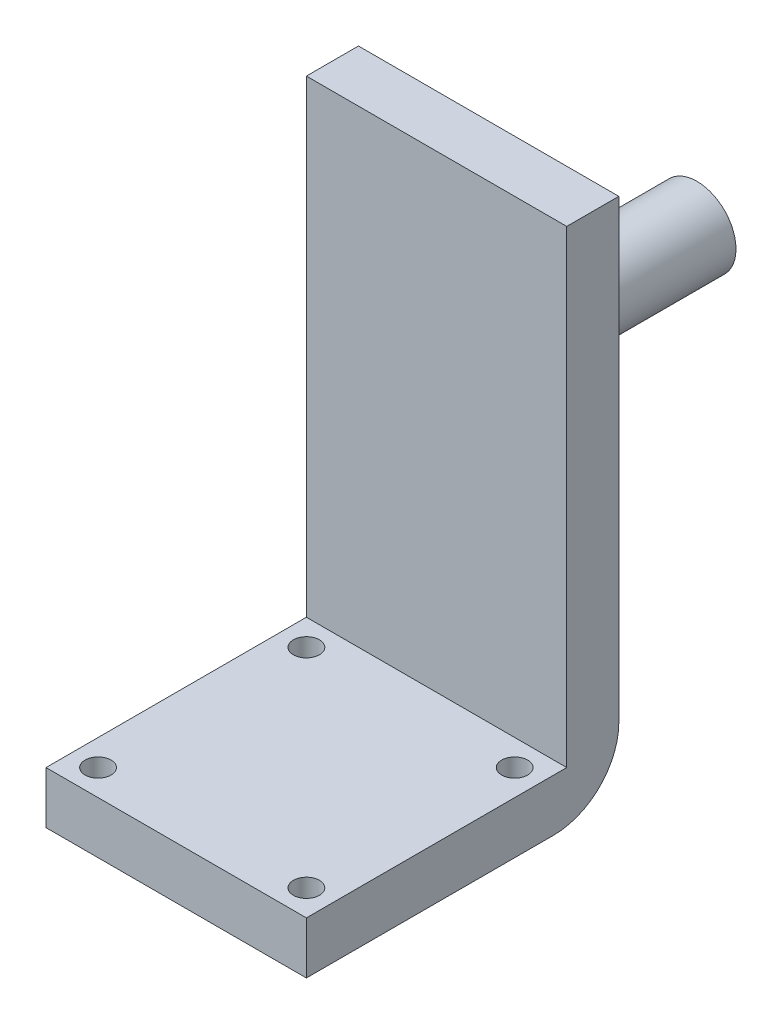
from build123d import *

# Parameters (mm, degrees)
SKETCH1_W           = 20
SKETCH1_H           = 20
SKETCH1_R           = 1
SKETCH1_R_2         = 0.9999999999999998
SKETCH1_R_3         = 1.0000000000000013
SKETCH1_R_4         = 0.9999999999999996
BOSS_EXTRUDE1_DEPTH = 4
SKETCH2_W           = 20
SKETCH2_H           = 40
SKETCH2_R           = 2.9999999999999996
BOSS_EXTRUDE2_DEPTH = 4
FILLET1_R           = 5
SKETCH3_R           = 2.9999999999999996
BOSS_EXTRUDE3_DEPTH = 20


with BuildPart() as part:
    # Sketch1 → Boss-Extrude1 (new body)
    with BuildSketch(Plane(origin=(0, 0, 0), x_dir=(1, 0, 0), z_dir=(0, 1, 0))):
        Rectangle(SKETCH1_W, SKETCH1_H)
        with Locations((-8.000000000000002, 8.000000000000002)):
            Circle(SKETCH1_R, mode=Mode.SUBTRACT)
        with Locations((-8.000000000000002, -7.999999999999998)):
            Circle(SKETCH1_R_2, mode=Mode.SUBTRACT)
        with Locations((7.999999999999998, -7.999999999999998)):
            Circle(SKETCH1_R_3, mode=Mode.SUBTRACT)
        with Locations((8, 8.000000000000002)):
            Circle(SKETCH1_R_4, mode=Mode.SUBTRACT)
    extrude(amount=BOSS_EXTRUDE1_DEPTH)

    # Sketch2 → Boss-Extrude2 (add)
    with BuildSketch(Plane(origin=(0, 0, -10.000000000000002), x_dir=(-1, 0, 0), z_dir=(0, 0, -1))):
        with Locations((1.78e-15, 20)):
            Rectangle(SKETCH2_W, SKETCH2_H)
        with Locations((0, 25)):
            Circle(SKETCH2_R, mode=Mode.SUBTRACT)
    extrude(amount=BOSS_EXTRUDE2_DEPTH)

    # Fillet1
    fillet1_edges = [part.edges().sort_by_distance(p)[0] for p in [
        (-1.78e-15, 0, -14.000000000000002),
    ]]
    fillet(fillet1_edges, radius=FILLET1_R)

    # Sketch3 → Boss-Extrude3 (add)
    with BuildSketch(Plane.XY.offset(-10.000000000000002)):
        with Locations((0, 25)):
            Circle(SKETCH3_R)
    extrude(amount=-BOSS_EXTRUDE3_DEPTH)


solid = part.part
